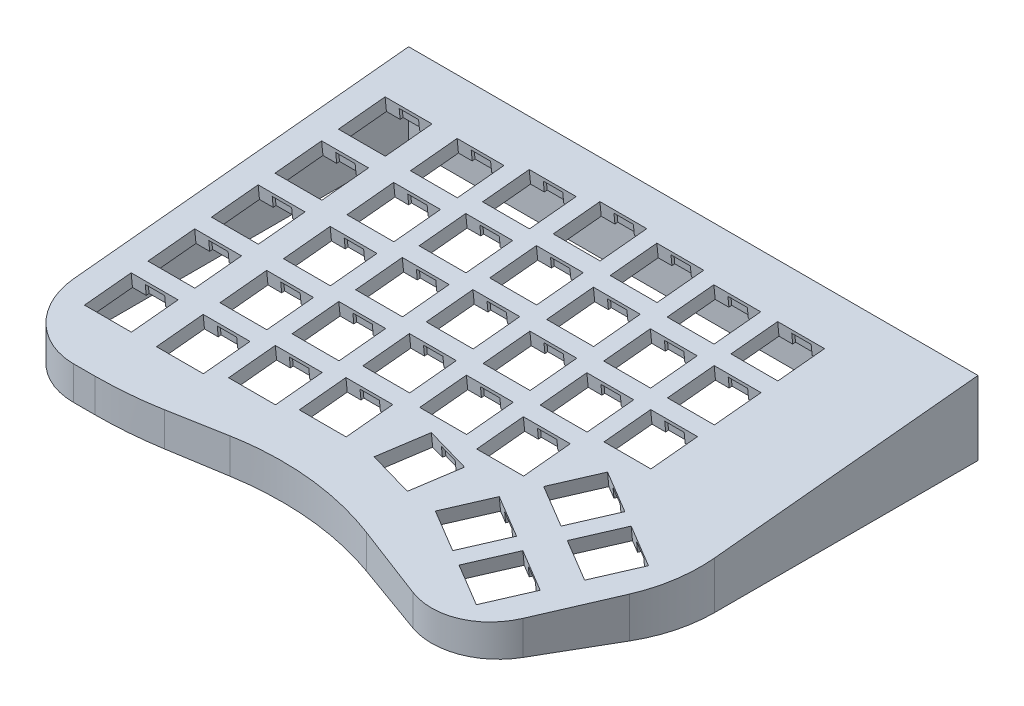
from build123d import *

# Parameters (mm, degrees)
BOSS_EXTRUDE1_REACH              = 234.163
FILLET1_R                        = 20
FILLET2_R                        = 120
FILLET3_R                        = 90
FILLET4_R                        = 20
FILLET5_R                        = 40
CUT_EXTRUDE1_REACH               = 128.863
CUT_EXTRUDE1_OFFSET_FROM_SURFACE = 4
SKETCH9_W                        = 14
SKETCH9_H                        = 14
CUT_EXTRUDE2_DEPTH               = 123.594310848
SKETCH11_W                       = 5.8
SKETCH11_H                       = 15.7
CUT_EXTRUDE4_DEPTH               = 3


with BuildPart() as part:
    # Boss-Extrude1: up to this plane
    boss_extrude1_end = Plane(origin=(0, 13.998205836, 1.399820584), z_dir=(0, 0.9950371902099893, 0.09950371902099893))
    # BodySketch → Boss-Extrude1 (new, up to the surface)
    with BuildSketch(Plane(origin=(0, 0, 0), x_dir=(1, 0, 0), z_dir=(0, 1, 0)), mode=Mode.PRIVATE) as boss_extrude1_sk1:
        Polygon((-78.182004481, 78.618121058), (91.817995519, 78.618121058), (91.817995519, -10.770377277), (66.462357254, -54.686161641), (7.173846236, -33.381878942), (-42.182004481, -41.381878942), (-78.182004481, -41.381878942), align=None)
    boss_extrude1_tool1 = split(extrude(boss_extrude1_sk1.sketch, amount=BOSS_EXTRUDE1_REACH, mode=Mode.PRIVATE), bisect_by=boss_extrude1_end, keep=Keep.BOTH, mode=Mode.PRIVATE)
    add(boss_extrude1_tool1.solids().sort_by_distance((6.615121, 0, -19.151024))[0])

    # Fillet1
    fillet1_edges = [part.edges().sort_by_distance(p)[0] for p in [
        (-78.182004481, 5, 41.381878942),
    ]]
    fillet(fillet1_edges, radius=FILLET1_R)

    # Fillet2
    fillet2_edges = [part.edges().sort_by_distance(p)[0] for p in [
        (-42.182004481, 5, 41.381878942),
    ]]
    fillet(fillet2_edges, radius=FILLET2_R)

    # Fillet3
    fillet3_edges = [part.edges().sort_by_distance(p)[0] for p in [
        (7.173846236, 5.4, 33.381878942),
    ]]
    fillet(fillet3_edges, radius=FILLET3_R)

    # Fillet4
    fillet4_edges = [part.edges().sort_by_distance(p)[0] for p in [
        (66.462357254, 4.334785865, 54.686161641),
    ]]
    fillet(fillet4_edges, radius=FILLET4_R)

    # Fillet5
    fillet5_edges = [part.edges().sort_by_distance(p)[0] for p in [
        (91.817995519, 6.530575083, 10.770377277),
    ]]
    fillet(fillet5_edges, radius=FILLET5_R)

    # Cut-Extrude1: up to this face of the body (flat: up to its plane, moved by the offset)
    cut_extrude1_end = Plane(part.part.faces().sort_by_distance((6.762619624, 16.086604926, -19.48417032))[0]).offset(-CUT_EXTRUDE1_OFFSET_FROM_SURFACE)
    # Sketch10 → Cut-Extrude1 (cut, up to the picked face)
    with BuildSketch(Plane.XZ, mode=Mode.PRIVATE) as cut_extrude1_sk1:
        with BuildLine():
            Line((87.817995519, -74.618121058), (87.817995519, 0.052099016))
            ThreePointArc((87.817995519, 0.052099016), (86.591257769, 9.369836537), (82.994649269, 18.052550704))
            Line((82.994649269, 18.052550704), (71.354481792, 38.213237631))
            ThreePointArc((71.354481792, 38.213237631), (63.001225649, 45.236904966), (52.087579757, 45.270436504))
            Line((52.087579757, 45.270436504), (30.408703544, 37.480513979))
            ThreePointArc((30.408703544, 37.480513979), (7.269980563, 32.341447345), (-16.418638896, 33.153737419))
            Line((-16.418638896, 33.153737419), (-33.284243726, 35.887452606))
            ThreePointArc((-33.284243726, 35.887452606), (-42.534210024, 37.007668766), (-51.844243726, 37.381878942))
            Line((-51.844243726, 37.381878942), (-58.182004481, 37.381878942))
            ThreePointArc((-58.182004481, 37.381878942), (-69.49571298, 32.695587441), (-74.182004481, 21.381878942))
            Line((-74.182004481, 21.381878942), (-74.182004481, -74.618121058))
            Line((-74.182004481, -74.618121058), (87.817995519, -74.618121058))
        make_face()
    cut_extrude1_tool1 = split(extrude(cut_extrude1_sk1.sketch, amount=-CUT_EXTRUDE1_REACH, mode=Mode.PRIVATE), bisect_by=cut_extrude1_end, keep=Keep.BOTH, mode=Mode.PRIVATE)
    add(cut_extrude1_tool1.solids().sort_by(Axis((6.822707, 0, -19.379922), (0, 1, 0)))[0], mode=Mode.SUBTRACT)

    # Sketch9 → Cut-Extrude2 (cut, through all)
    with BuildSketch(Plane(origin=(0, 13.998205836, 1.399820584), x_dir=(1, 0, 0), z_dir=(0, 0.9950371902099893, 0.09950371902099897))):
        with Locations((-63.225979115, 58.369576878)):
            Rectangle(SKETCH9_W, SKETCH9_H)
        with Locations((-63.225979115, 39.319576878)):
            Rectangle(SKETCH9_W, SKETCH9_H)
        with Locations((-63.225979115, 20.269576878)):
            Rectangle(SKETCH9_W, SKETCH9_H)
        with Locations((-63.225979115, 1.219576878)):
            Rectangle(SKETCH9_W, SKETCH9_H)
        with Locations((-41.725979115, 58.369576878)):
            Rectangle(SKETCH9_W, SKETCH9_H)
        with Locations((-41.725979115, 39.319576878)):
            Rectangle(SKETCH9_W, SKETCH9_H)
        with Locations((-41.725979115, 20.269576878)):
            Rectangle(SKETCH9_W, SKETCH9_H)
        with Locations((-41.725979115, 1.219576878)):
            Rectangle(SKETCH9_W, SKETCH9_H)
        with Locations((-22.675979115, 60.869576878)):
            Rectangle(SKETCH9_W, SKETCH9_H)
        with Locations((-22.675979115, 41.819576878)):
            Rectangle(SKETCH9_W, SKETCH9_H)
        with Locations((-22.675979115, 22.769576878)):
            Rectangle(SKETCH9_W, SKETCH9_H)
        with Locations((-22.675979115, 3.719576878)):
            Rectangle(SKETCH9_W, SKETCH9_H)
        with Locations((-3.625979115, 5.769576878)):
            Rectangle(SKETCH9_W, SKETCH9_H)
        with Locations((-3.625979115, 43.869576878)):
            Rectangle(SKETCH9_W, SKETCH9_H)
        with Locations((-3.625979115, 62.919576878)):
            Rectangle(SKETCH9_W, SKETCH9_H)
        with Locations((-3.625979115, 24.819576878)):
            Rectangle(SKETCH9_W, SKETCH9_H)
        with Locations((15.424020885, 22.769576878)):
            Rectangle(SKETCH9_W, SKETCH9_H)
        with Locations((15.424020885, 3.719576878)):
            Rectangle(SKETCH9_W, SKETCH9_H)
        with Locations((15.424020885, 60.869576878)):
            Rectangle(SKETCH9_W, SKETCH9_H)
        with Locations((15.424020885, 41.819576878)):
            Rectangle(SKETCH9_W, SKETCH9_H)
        with Locations((34.474020885, 1.669576878)):
            Rectangle(SKETCH9_W, SKETCH9_H)
        with Locations((34.474020885, 58.819576878)):
            Rectangle(SKETCH9_W, SKETCH9_H)
        with Locations((34.474020885, 20.719576878)):
            Rectangle(SKETCH9_W, SKETCH9_H)
        with Locations((34.474020885, 39.769576878)):
            Rectangle(SKETCH9_W, SKETCH9_H)
        with Locations((53.524020885, 20.719576878)):
            Rectangle(SKETCH9_W, SKETCH9_H)
        with Locations((53.524020885, 39.769576878)):
            Rectangle(SKETCH9_W, SKETCH9_H)
        with Locations((53.524020885, 58.819576878)):
            Rectangle(SKETCH9_W, SKETCH9_H)
        with Locations((-3.625979115, -13.280423122)):
            Rectangle(SKETCH9_W, SKETCH9_H)
        with Locations((-63.225979115, -17.830423122)):
            Rectangle(SKETCH9_W, SKETCH9_H)
        with Locations((-41.725979115, -17.830423122)):
            Rectangle(SKETCH9_W, SKETCH9_H)
        with Locations((-22.675979115, -15.330423122)):
            Rectangle(SKETCH9_W, SKETCH9_H)
        Polygon((54.450765987, -20.490769721), (47.45512084, -32.617638607), (35.328251954, -25.621993461), (42.3238971, -13.495124575), align=None)
        Polygon((63.745608717, -14.599266942), (70.741253864, -2.472398056), (82.86812275, -9.468043202), (75.872477604, -21.594912089), align=None)
        Polygon((71.001620358, -30.038486047), (64.005975212, -42.165354934), (51.879106325, -35.169709787), (58.874751472, -23.042840901), align=None)
        Polygon((54.190399492, 7.07531827), (66.317268379, 0.079673124), (59.321623232, -12.047195762), (47.194754346, -5.051550616), align=None)
        Polygon((16.220977245, -7.635322475), (29.743875036, -11.259027118), (26.120170392, -24.781924909), (12.597272602, -21.158220266), align=None)
    extrude(amount=-CUT_EXTRUDE2_DEPTH, mode=Mode.SUBTRACT)

    # Sketch11 → Cut-Extrude4 (cut)
    with BuildSketch(Plane(origin=(0, 10.018057075, 1.001805708), x_dir=(1, 0, 0), z_dir=(0, -0.9950371902099893, -0.09950371902099897))):
        with Locations((-63.225979115, 17.830423122)):
            Rectangle(SKETCH11_W, SKETCH11_H)
        with Locations((-41.725979115, 17.830423122)):
            Rectangle(SKETCH11_W, SKETCH11_H)
        with Locations((-22.675979115, 15.330423122)):
            Rectangle(SKETCH11_W, SKETCH11_H)
        with Locations((-3.625979115, 13.280423122)):
            Rectangle(SKETCH11_W, SKETCH11_H)
        with Locations((-3.625979115, -5.769576878)):
            Rectangle(SKETCH11_W, SKETCH11_H)
        with Locations((-22.675979115, -3.719576878)):
            Rectangle(SKETCH11_W, SKETCH11_H)
        with Locations((-41.725979115, -1.219576878)):
            Rectangle(SKETCH11_W, SKETCH11_H)
        with Locations((-63.225979115, -1.219576878)):
            Rectangle(SKETCH11_W, SKETCH11_H)
        with Locations((-63.225979115, -20.269576878)):
            Rectangle(SKETCH11_W, SKETCH11_H)
        with Locations((-41.725979115, -20.269576878)):
            Rectangle(SKETCH11_W, SKETCH11_H)
        with Locations((-22.675979115, -22.769576878)):
            Rectangle(SKETCH11_W, SKETCH11_H)
        with Locations((-3.625979115, -24.819576878)):
            Rectangle(SKETCH11_W, SKETCH11_H)
        with Locations((-3.625979115, -43.869576878)):
            Rectangle(SKETCH11_W, SKETCH11_H)
        with Locations((-22.675979115, -41.819576878)):
            Rectangle(SKETCH11_W, SKETCH11_H)
        with Locations((-41.725979115, -39.319576878)):
            Rectangle(SKETCH11_W, SKETCH11_H)
        with Locations((-63.225979115, -39.319576878)):
            Rectangle(SKETCH11_W, SKETCH11_H)
        with Locations((-63.225979115, -58.369576878)):
            Rectangle(SKETCH11_W, SKETCH11_H)
        with Locations((-41.725979115, -58.369576878)):
            Rectangle(SKETCH11_W, SKETCH11_H)
        with Locations((-22.675979115, -60.869576878)):
            Rectangle(SKETCH11_W, SKETCH11_H)
        with Locations((-3.625979115, -62.919576878)):
            Rectangle(SKETCH11_W, SKETCH11_H)
        with Locations((15.424020885, -60.869576878)):
            Rectangle(SKETCH11_W, SKETCH11_H)
        with Locations((15.424020885, -41.819576878)):
            Rectangle(SKETCH11_W, SKETCH11_H)
        with Locations((15.424020885, -22.769576878)):
            Rectangle(SKETCH11_W, SKETCH11_H)
        with Locations((15.424020885, -3.719576878)):
            Rectangle(SKETCH11_W, SKETCH11_H)
        with Locations((34.474020885, -1.669576878)):
            Rectangle(SKETCH11_W, SKETCH11_H)
        with Locations((34.474020885, -20.719576878)):
            Rectangle(SKETCH11_W, SKETCH11_H)
        with Locations((53.524020885, -20.719576878)):
            Rectangle(SKETCH11_W, SKETCH11_H)
        with Locations((34.474020885, -39.769576878)):
            Rectangle(SKETCH11_W, SKETCH11_H)
        with Locations((53.524020885, -39.769576878)):
            Rectangle(SKETCH11_W, SKETCH11_H)
        with Locations((53.524020885, -58.819576878)):
            Rectangle(SKETCH11_W, SKETCH11_H)
        with Locations((34.474020885, -58.819576878)):
            Rectangle(SKETCH11_W, SKETCH11_H)
        Polygon((38.454956529, 28.406992293), (46.300072872, 14.807575042), (51.324061411, 17.705770889), (43.478945068, 31.30518814), align=None)
        Polygon((16.337539173, 23.040481134), (20.401265094, 7.875517183), (26.003608464, 9.37676625), (21.939882543, 24.541730201), align=None)
        Polygon((62.850927244, 24.355291369), (67.874915782, 27.253487215), (60.02979944, 40.852904466), (55.005810901, 37.95470862), align=None)
        Polygon((74.717429636, 3.784848524), (79.741418174, 6.68304437), (71.896301832, 20.282461621), (66.872313293, 17.384265775), align=None)
        Polygon((58.166575264, -5.762867803), (63.190563803, -2.864671956), (55.34544746, 10.734745295), (50.321458922, 7.836549448), align=None)
    extrude(amount=-CUT_EXTRUDE4_DEPTH, mode=Mode.SUBTRACT)


solid = part.part
